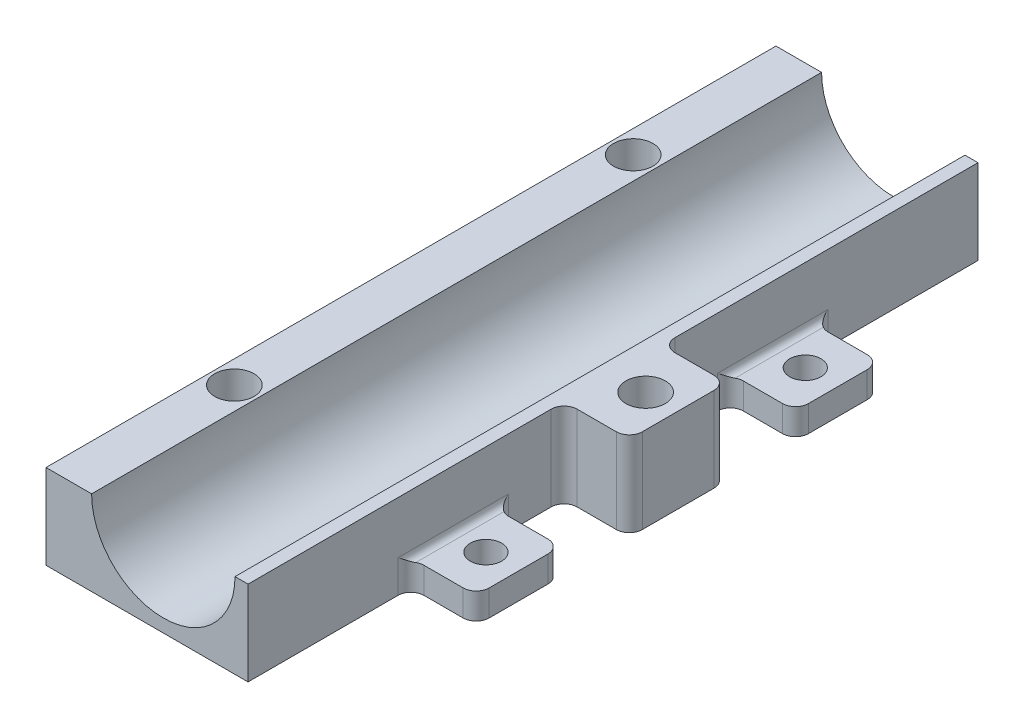
from build123d import *

# Parameters (mm, degrees)
BOSS_EXTRUDE1_DEPTH  = 112
SKETCH2_R            = 3.025
CUT_EXTRUDE1_DEPTH   = 8
SKETCH3_W            = 11
SKETCH3_H            = 11
BOSS_EXTRUDE2_DEPTH  = 4
BOSS_EXTRUDE3_REACH  = 126.988
SKETCH8_W            = 10
SKETCH8_H            = 13
BOSS_EXTRUDE4_DEPTH  = 4
FILLET1_R            = 2
M4_CLEARANCE_HOLE1_D = 4.8
MIRROR1_START        = 12.831076745
MIRROR1_OUTLINE_W    = 4
MIRROR1_OUTLINE_H    = 13
MIRROR1_DEPTH        = 2.768923155
MIRROR1_START_2      = 20.4000001
MIRROR1_2_OUTLINE_W  = 4
MIRROR1_2_OUTLINE_H  = 13
MIRROR1_2_DEPTH      = 0.5999999
MIRROR1_START_3      = 74
MIRROR1_3_DEPTH      = 13
MIRROR1_4_OUTLINE_W  = 4.8000002
MIRROR1_4_OUTLINE_H  = 4
MIRROR1_4_DEPTH      = 4.0999999
MIRROR1_START_4      = 82.9000001
MIRROR1_5_OUTLINE_W  = 4.8000002
MIRROR1_5_OUTLINE_H  = 4
MIRROR1_5_DEPTH      = 4.0999999
MIRROR1_START_5      = 76
MIRROR1_6_OUTLINE_W  = 2
MIRROR1_6_OUTLINE_H  = 4
MIRROR1_6_DEPTH      = 9
MIRROR1_START_6      = -13
MIRROR1_7_DEPTH      = 4
CUT_EXTRUDE2_DEPTH   = 126.455171276
BOSS_EXTRUDE5_START  = -87
BOSS_EXTRUDE5_DEPTH  = 112
SKETCH15_W           = 10
SKETCH15_H           = 15
SKETCH15_R           = 3.025
BOSS_EXTRUDE6_DEPTH  = 13
SKETCH16_R           = 3.025
CUT_EXTRUDE3_DEPTH   = 8
FILLET2_R            = 2
FILLET3_R            = 1


with BuildPart() as part:
    # Sketch1 → Boss-Extrude1 (new body)
    with BuildSketch(Plane.XY):
        with BuildLine():
            ThreePointArc((0, -13), (-9.192388155, -9.192388155), (-13, 0))
            Line((-13, 0), (-18, 0))
            Line((-18, 0), (-18, -13))
            Line((-18, -13), (0, -13))
        make_face()
        with BuildLine():
            Line((-11, 0), (-13, 0))
            ThreePointArc((-13, 0), (-9.192388155, -9.192388155), (0, -13))
            ThreePointArc((0, -13), (9.192388155, -9.192388155), (13, 0))
            Line((13, 0), (11, 0))
            ThreePointArc((11, 0), (0, -11), (-11, 0))
        make_face()
    extrude(amount=BOSS_EXTRUDE1_DEPTH)

    # Sketch2 → Cut-Extrude1 (cut)
    with BuildSketch(Plane(origin=(0, 0, 0), x_dir=(1, 0, 0), z_dir=(0, 1, 0))):
        with Locations(Location((-14.5, -25.4, 0), (0, 0, 180))):
            Circle(SKETCH2_R)
        with Locations(Location((-14.5, -86.6, 0), (0, 0, 180))):
            Circle(SKETCH2_R)
    extrude(amount=-CUT_EXTRUDE1_DEPTH, mode=Mode.SUBTRACT)

    # Sketch3 → Boss-Extrude2 (add)
    with BuildSketch(Plane.XZ.offset(13)):
        with Locations((-12.5, 117.5)):
            Rectangle(SKETCH3_W, SKETCH3_H)
    extrude(amount=-BOSS_EXTRUDE2_DEPTH)

    # Sketch7 → Boss-Extrude3 (add, up to next)
    with BuildSketch(Plane.XZ.offset(13), mode=Mode.PRIVATE) as boss_extrude3_sk1:
        Polygon((0, 25), (13, 25), (13, 31.5), (13, 38), (0, 38), align=None)
    boss_extrude3_tool1 = extrude(boss_extrude3_sk1.sketch, amount=-BOSS_EXTRUDE3_REACH, mode=Mode.PRIVATE) - part.part
    add(boss_extrude3_tool1.solids().sort_by_distance((6.5, -13, 31.5))[0])

    # Sketch8 → Boss-Extrude4 (add)
    with BuildSketch(Plane.XZ.offset(13)):
        with Locations((18, 31.5)):
            Rectangle(SKETCH8_W, SKETCH8_H)
    extrude(amount=-BOSS_EXTRUDE4_DEPTH)

    # Fillet1
    fillet1_edges = [part.edges().sort_by_distance(p)[0] for p in [
        (-18, -11, 123),
        (-7, -11, 123),
        (23, -11, 38),
        (23, -11, 25),
    ]]
    fillet(fillet1_edges, radius=FILLET1_R)

    # M4 Clearance Hole1 (through all)
    with Locations(Plane(origin=(0, -9, 0), x_dir=(1, 0, 0), z_dir=(0, 1, 0))):
        with Locations((-12.5, -117.5), (18, -31.5)):
            Hole(M4_CLEARANCE_HOLE1_D / 2)



with BuildPart() as body_2:
    # Mirror1: read off the stored shape, not the designer's step
    # Mirror1 outline → Mirror1 (new body)
    with BuildSketch(Plane.YZ.offset(MIRROR1_START)):
        with Locations((-11, 80.5)):
            Rectangle(MIRROR1_OUTLINE_W, MIRROR1_OUTLINE_H)
    extrude(amount=MIRROR1_DEPTH)


with BuildPart() as body_3:
    # Mirror1 2 outline → Mirror1 2 (new body)
    with BuildSketch(Plane.YZ.offset(MIRROR1_START_2)):
        with Locations((-11, 80.5)):
            Rectangle(MIRROR1_2_OUTLINE_W, MIRROR1_2_OUTLINE_H)
    extrude(amount=MIRROR1_2_DEPTH)


with BuildPart() as part_1:
    add(part.part)

    add(body_2.part)  # Mirror1 3 merges body 2
    # Mirror1 3 outline → Mirror1 3 (add)
    with BuildSketch(Plane.XY.offset(MIRROR1_START_3)):
        with BuildLine():
            Line((15.5999999, -9), (13, -9))
            Line((13, -9), (13, 0))
            ThreePointArc((13, 0), (9.192388155, -9.192388155), (0, -13))
            Line((0, -13), (12.831076745, -13))
            Line((12.831076745, -13), (15.5999999, -13))
            Line((15.5999999, -13), (15.5999999, -9))
        make_face()
    extrude(amount=MIRROR1_3_DEPTH)


    add(body_3.part)  # Mirror1 4 merges body 3
    # Mirror1 4 outline → Mirror1 4 (add)
    with BuildSketch(Plane.XY.offset(MIRROR1_START_3)):
        with Locations((18, -11)):
            Rectangle(MIRROR1_4_OUTLINE_W, MIRROR1_4_OUTLINE_H)
    extrude(amount=MIRROR1_4_DEPTH)

    # Mirror1 5 outline → Mirror1 5 (add)
    with BuildSketch(Plane.XY.offset(MIRROR1_START_4)):
        with Locations((18, -11)):
            Rectangle(MIRROR1_5_OUTLINE_W, MIRROR1_5_OUTLINE_H)
    extrude(amount=MIRROR1_5_DEPTH)

    # Mirror1 6 outline → Mirror1 6 (add)
    with BuildSketch(Plane.XY.offset(MIRROR1_START_5)):
        with Locations((22, -11)):
            Rectangle(MIRROR1_6_OUTLINE_W, MIRROR1_6_OUTLINE_H)
    extrude(amount=MIRROR1_6_DEPTH)

    # Mirror1 7 outline → Mirror1 7 (add)
    with BuildSketch(Plane(origin=(0, 0, 0), x_dir=(1, 0, 0), z_dir=(0, 1, 0)).offset(MIRROR1_START_6)):
        with BuildLine():
            ThreePointArc((23, -76), (22.414213562, -74.585786438), (21, -74))
            Line((21, -74), (21, -76))
            Line((21, -76), (23, -76))
        make_face()
        with BuildLine():
            Line((21, -85), (21, -87))
            ThreePointArc((21, -87), (22.414213562, -86.414213562), (23, -85))
            Line((23, -85), (21, -85))
        make_face()
        with BuildLine():
            Line((20.4000001, -82.9000001), (20.4, -80.5))
            ThreePointArc((20.4, -80.5), (19.697056275, -82.197056275), (18, -82.9))
            Line((18, -82.9), (20.4000001, -82.9000001))
        make_face()
        with BuildLine():
            ThreePointArc((18, -78.1), (19.697056275, -78.802943725), (20.4, -80.5))
            Line((20.4, -80.5), (20.4000001, -78.0999999))
            Line((20.4000001, -78.0999999), (18, -78.1))
        make_face()
        with BuildLine():
            ThreePointArc((15.6, -80.5), (16.302943725, -78.802943725), (18, -78.1))
            Line((18, -78.1), (15.5999999, -78.0999999))
            Line((15.5999999, -78.0999999), (15.6, -80.5))
        make_face()
        with BuildLine():
            Line((15.5999999, -82.9000001), (18, -82.9))
            ThreePointArc((18, -82.9), (16.302943725, -82.197056275), (15.6, -80.5))
            Line((15.6, -80.5), (15.5999999, -82.9000001))
        make_face()
    extrude(amount=MIRROR1_7_DEPTH)

    # Sketch12 → Cut-Extrude2 (cut, through all)
    with BuildSketch(Plane(origin=(0, -9, 0), x_dir=(1, 0, 0), z_dir=(0, 1, 0))):
        with BuildLine():
            Line((-18, -112), (-18, -121))
            ThreePointArc((-18, -121), (-17.414213562, -122.414213562), (-16, -123))
            Line((-16, -123), (-9, -123))
            ThreePointArc((-9, -123), (-7.585786438, -122.414213562), (-7, -121))
            Line((-7, -121), (-7, -112))
            Line((-7, -112), (-18, -112))
        make_face()
    extrude(amount=-CUT_EXTRUDE2_DEPTH, mode=Mode.SUBTRACT)

    # Sketch13 → Boss-Extrude5 (add)
    with BuildSketch(Plane.XY.offset(87).offset(BOSS_EXTRUDE5_START)):
        with BuildLine():
            Line((13, -13), (13, -9))
            Line((13, -9), (13, 0))
            ThreePointArc((13, 0), (9.192388155, -9.192388155), (0, -13))
            Line((0, -13), (13, -13))
        make_face()
    extrude(amount=BOSS_EXTRUDE5_DEPTH)

    # Sketch15 → Boss-Extrude6 (add)
    # profile 1 of 2: a face of its own
    with BuildSketch(Plane.XZ.offset(13)):
        with Locations((18, 56)):
            Rectangle(SKETCH15_W, SKETCH15_H)
        with Locations((18, 56)):
            Circle(SKETCH15_R, mode=Mode.SUBTRACT)
    # profile 2 of 2: a face of its own
    with BuildSketch(Plane.XZ.offset(13)):
        with Locations((18, 56)):
            Circle(SKETCH15_R)
    extrude(amount=-BOSS_EXTRUDE6_DEPTH)

    # Sketch16 → Cut-Extrude3 (cut)
    with BuildSketch(Plane(origin=(0, 0, 0), x_dir=(1, 0, 0), z_dir=(0, 1, 0))):
        with Locations(Location((18, -56, 0), (0, 0, 270))):
            Circle(SKETCH16_R)
    extrude(amount=-CUT_EXTRUDE3_DEPTH, mode=Mode.SUBTRACT)

    # Fillet2
    fillet2_edges = [part_1.edges().sort_by_distance(p)[0] for p in [
        (13, -11, 25),
        (13, -11, 38),
        (13, -11, 74),
        (13, -11, 87),
        (23, -6.5, 63.5),
        (23, -6.5, 48.5),
        (13, -6.5, 48.5),
        (13, -6.5, 63.5),
    ]]
    fillet(fillet2_edges, radius=FILLET2_R)

    # Fillet3
    fillet3_edges = [part_1.edges().sort_by_distance(p)[0] for p in [
        (13, -9, 80.5),
        (13, -9, 31.5),
    ]]
    fillet(fillet3_edges, radius=FILLET3_R)


solid = part_1.part
